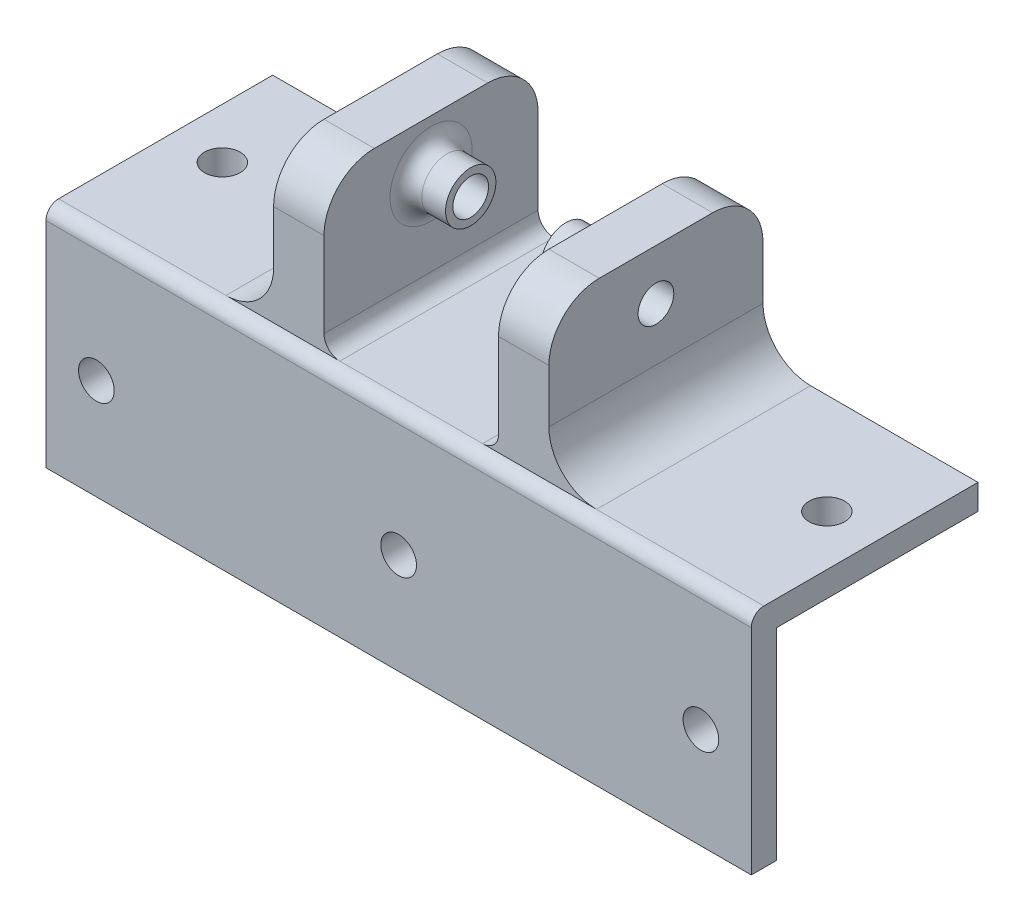
from build123d import *

# Parameters (mm, degrees)
SKETCH1_W           = 88.9
SKETCH1_H           = 25.4
SKETCH1_R           = 2.25
BOSS_EXTRUDE1_DEPTH = 3.175
SKETCH2_W           = 88.9
SKETCH2_H           = 28.575
SKETCH2_R           = 2.25
BOSS_EXTRUDE2_DEPTH = 3.175
FILLET1_R           = 1.5875
BOSS_EXTRUDE3_DEPTH = 19.05
SKETCH5_R           = 2.25
CUT_EXTRUDE1_DEPTH  = 100
FILLET2_R           = 6.35
BOSS_EXTRUDE4_START = 5
SKETCH6_R           = 3.175
SKETCH6_R_2         = 2.25
BOSS_EXTRUDE4_DEPTH = 5
FILLET3_R           = 2
FILLET4_R           = 6
FILLET5_R           = 2


with BuildPart() as part:
    # Sketch1 → Boss-Extrude1 (new body)
    with BuildSketch(Plane.XY):
        Rectangle(SKETCH1_W, SKETCH1_H)
        Circle(SKETCH1_R, mode=Mode.SUBTRACT)
        with Locations((-38.1, 0)):
            Circle(SKETCH1_R, mode=Mode.SUBTRACT)
        with Locations((38.1, 0)):
            Circle(SKETCH1_R, mode=Mode.SUBTRACT)
    extrude(amount=BOSS_EXTRUDE1_DEPTH)

    # Sketch2 → Boss-Extrude2 (add)
    with BuildSketch(Plane(origin=(0, 12.7, 0), x_dir=(1, 0, 0), z_dir=(0, 1, 0))):
        with Locations((0, 11.1125)):
            Rectangle(SKETCH2_W, SKETCH2_H)
        with Locations(Location((0, 12.7, 0), (0, 0, 180))):
            Circle(SKETCH2_R, mode=Mode.SUBTRACT)
        with Locations(Location((-38.1, 12.7, 0), (0, 0, 180))):
            Circle(SKETCH2_R, mode=Mode.SUBTRACT)
        with Locations(Location((38.1, 12.7, 0), (0, 0, 180))):
            Circle(SKETCH2_R, mode=Mode.SUBTRACT)
    extrude(amount=BOSS_EXTRUDE2_DEPTH)

    # Fillet1
    fillet1_edges = [part.edges().sort_by_distance(p)[0] for p in [
        (0, 15.875, 3.175),
    ]]
    fillet(fillet1_edges, radius=FILLET1_R)

    # Sketch4 → Boss-Extrude3 (add)
    with BuildSketch(Plane(origin=(0, 15.875, 0), x_dir=(1, 0, 0), z_dir=(0, 1, 0))):
        Polygon((-11, 12.7), (-11, 25.4), (-17.35, 25.4), (-17.35, 12.7), (-17.35, -1.5875), (-11, -1.5875), align=None)
        Polygon((11, 25.4), (11, 12.7), (11, -1.5875), (17.35, -1.5875), (17.35, 12.7), (17.35, 25.4), align=None)
    extrude(amount=BOSS_EXTRUDE3_DEPTH)

    # Sketch5 → Cut-Extrude1 (cut)
    with BuildSketch(Plane(origin=(17.35, 0, 0), x_dir=(0, 0, -1), z_dir=(1, 0, 0))):
        with Locations(Location((11.90625, 28.575, 0), (0, 0, 90))):
            Circle(SKETCH5_R)
    extrude(amount=-CUT_EXTRUDE1_DEPTH, mode=Mode.SUBTRACT)

    # Fillet2
    fillet2_edges = [part.edges().sort_by_distance(p)[0] for p in [
        (-14.175, 34.925, -25.4),
        (-14.175, 34.925, 1.5875),
        (14.175, 34.925, -25.4),
        (14.175, 34.925, 1.5875),
    ]]
    fillet(fillet2_edges, radius=FILLET2_R)

    # Sketch6 → Boss-Extrude4 (add)
    with BuildSketch(Plane(origin=(-11, 0, 0), x_dir=(0, 0, -1), z_dir=(1, 0, 0)).offset(BOSS_EXTRUDE4_START)):
        with Locations((11.90625, 28.575)):
            Circle(SKETCH6_R)
        with Locations(Location((11.90625, 28.575, 0), (0, 0, 90))):
            Circle(SKETCH6_R_2, mode=Mode.SUBTRACT)
    extrude(amount=-BOSS_EXTRUDE4_DEPTH)

    # Fillet3
    fillet3_edges = [part.edges().sort_by_distance(p)[0] for p in [
        (-11, 28.575, -8.73125),
    ]]
    fillet(fillet3_edges, radius=FILLET3_R)

    # Mirror2: part across plane


with BuildPart() as part_1:
    add(part.part)
    add(part.part.mirror(Plane(origin=(0, 0, 0), x_dir=(0, 0, 1), z_dir=(1, 0, 0))))

    # Fillet4
    # the kernel refuses this fillet: 6 mm, written as the material it adds along each edge
    with BuildSketch(Plane(origin=(-17.35, 15.875, -25.4), x_dir=(0, 1, 0), z_dir=(0, 0, 1))) as fillet4_piece_1:
        with BuildLine():
            CenterArc((FILLET4_R, FILLET4_R), FILLET4_R, 180, 90)
            Line((0, FILLET4_R), (0, 0))
            Line((0, 0), (FILLET4_R, 0))
        make_face()
    extrude(amount=26.9875)
    with BuildSketch(Plane(origin=(17.35, 15.875, 1.5875), x_dir=(1, 0, 0), z_dir=(0, 0, -1))) as fillet4_piece_2:
        with BuildLine():
            CenterArc((FILLET4_R, -FILLET4_R), FILLET4_R, 90, 90)
            Line((0, -FILLET4_R), (0, 0))
            Line((0, 0), (FILLET4_R, 0))
        make_face()
    extrude(amount=26.9875)

    # Fillet5
    # the kernel refuses this fillet: 2 mm, written as the material it adds along each edge
    with BuildSketch(Plane(origin=(-11, 15.875, 1.5875), x_dir=(0, 1, 0), z_dir=(0, 0, -1))) as fillet5_piece_1:
        with BuildLine():
            CenterArc((FILLET5_R, FILLET5_R), FILLET5_R, 180, 90)
            Line((0, FILLET5_R), (0, 0))
            Line((0, 0), (FILLET5_R, 0))
        make_face()
    extrude(amount=26.9875)
    with BuildSketch(Plane(origin=(11, 15.875, -25.4), x_dir=(-1, 0, 0), z_dir=(0, 0, 1))) as fillet5_piece_2:
        with BuildLine():
            CenterArc((FILLET5_R, -FILLET5_R), FILLET5_R, 90, 90)
            Line((0, -FILLET5_R), (0, 0))
            Line((0, 0), (FILLET5_R, 0))
        make_face()
    extrude(amount=26.9875)


solid = part_1.part
